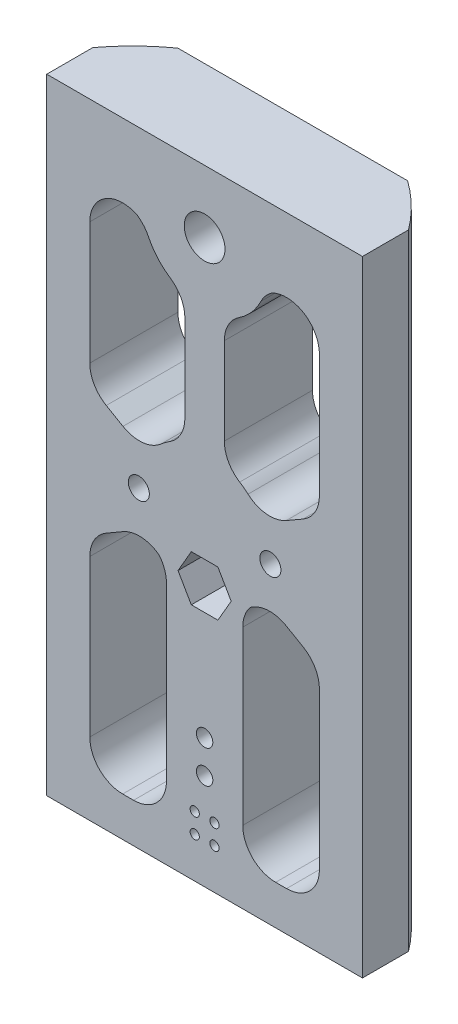
from build123d import *

# Parameters (mm, degrees)
SKETCH1_W           = 14
SKETCH1_H           = 25
BOSS_EXTRUDE1_DEPTH = 6.4
SKETCH3_W           = 14
SKETCH3_H           = 25
SKETCH3_R           = 0.7
SKETCH3_R_2         = 1.25
BOSS_EXTRUDE3_DEPTH = 7
BOSS_EXTRUDE4_START = -25
BOSS_EXTRUDE4_DEPTH = 25
BOSS_EXTRUDE5_START = 70
BOSS_EXTRUDE5_DEPTH = 70
CUT_EXTRUDE1_REACH  = 150.074
SKETCH6_R           = 2.25
CUT_EXTRUDE2_DEPTH  = 7.4
CUT_EXTRUDE4_REACH  = 150.074
SKETCH9_R           = 1.6
CUT_EXTRUDE5_DEPTH  = 7.4
CUT_EXTRUDE6_REACH  = 150.074
SKETCH11_R          = 3.1
CUT_EXTRUDE7_DEPTH  = 6
CUT_EXTRUDE8_REACH  = 150.074
FILLET1_R           = 5


with BuildPart() as part:
    # Sketch1 → Boss-Extrude1 (new body)
    with BuildSketch(Plane.XY):
        with Locations((0, -133)):
            Rectangle(SKETCH1_W, SKETCH1_H)
        Polygon((-2.275, -128.6), (-2.275, -128.15), (-2.275, -123.6), (2.275, -123.6), (2.275, -128.15), (2.275, -128.6), (2.275, -133.15), (2.275, -134.025), (3.8, -134.025), (3.8, -141.625), (1, -141.625), (1, -142.4), (-1, -142.4), (-1, -141.625), (-3.8, -141.625), (-3.8, -134.025), (-2.275, -134.025), (-2.275, -133.15), align=None, mode=Mode.SUBTRACT)
    extrude(amount=-BOSS_EXTRUDE1_DEPTH)

    # Sketch3 → Boss-Extrude3 (add)
    with BuildSketch(Plane.XY):
        with Locations((0, -133)):
            Rectangle(SKETCH3_W, SKETCH3_H)
        with Locations((-1.5, -139.325)):
            Circle(SKETCH3_R, mode=Mode.SUBTRACT)
        with Locations((-1.5, -136.325)):
            Circle(SKETCH3_R, mode=Mode.SUBTRACT)
        with Locations((1.5, -136.325)):
            Circle(SKETCH3_R, mode=Mode.SUBTRACT)
        with Locations((1.5, -139.325)):
            Circle(SKETCH3_R, mode=Mode.SUBTRACT)
        with Locations((0, -130.875)):
            Circle(SKETCH3_R_2, mode=Mode.SUBTRACT)
        with Locations((0, -125.875)):
            Circle(SKETCH3_R_2, mode=Mode.SUBTRACT)
    extrude(amount=BOSS_EXTRUDE3_DEPTH)

    # Sketch4 → Boss-Extrude4 (add)
    with BuildSketch(Plane.XZ.offset(145.5).offset(BOSS_EXTRUDE4_START)):
        with BuildLine():
            Line((-17.453939383, -6.4), (-7, -6.4))
            Line((-7, -6.4), (-7, 7))
            Line((-7, 7), (-24, 7))
            Line((-24, 7), (-24, 0))
            ThreePointArc((-24, 0), (-20.972536151, -3.45117077), (-17.453939383, -6.4))
        make_face()
        with BuildLine():
            Line((7, 7), (7, -6.4))
            Line((7, -6.4), (17.453939383, -6.4))
            ThreePointArc((17.453939383, -6.4), (20.972536151, -3.45117077), (24, 0))
            Line((24, 0), (24, 7))
            Line((24, 7), (7, 7))
        make_face()
    extrude(amount=BOSS_EXTRUDE4_DEPTH)

    # Sketch5 → Boss-Extrude5 (add)
    with BuildSketch(Plane(origin=(0, -120.5, 0), x_dir=(1, 0, 0), z_dir=(0, 1, 0)).offset(BOSS_EXTRUDE5_START)):
        with BuildLine():
            Line((17.453939383, 6.4), (-17.453939383, 6.4))
            ThreePointArc((-17.453939383, 6.4), (-20.972536151, 3.45117077), (-24, 0))
            Line((-24, 0), (-24, -7))
            Line((-24, -7), (24, -7))
            Line((24, -7), (24, 0))
            ThreePointArc((24, 0), (20.972536151, 3.45117077), (17.453939383, 6.4))
        make_face()
    extrude(amount=-BOSS_EXTRUDE5_DEPTH)

    # Sketch6 → Cut-Extrude1 (cut, up to next)
    with BuildSketch(Plane.XY.offset(7), mode=Mode.PRIVATE) as cut_extrude1_sk1:
        with Locations((0, -105.875)):
            Circle(SKETCH6_R)
    cut_extrude1_tool1 = extrude(cut_extrude1_sk1.sketch, amount=-CUT_EXTRUDE1_REACH, mode=Mode.PRIVATE) & part.part
    add(cut_extrude1_tool1.solids().sort_by_distance((0, -105.875, 7))[0], mode=Mode.SUBTRACT)

    # Sketch7 → Cut-Extrude2 (cut)
    with BuildSketch(Plane.XY.offset(7)):
        Polygon((4.041451884, -105.875), (2.020725942, -102.375), (-2.020725942, -102.375), (-4.041451884, -105.875), (-2.020725942, -109.375), (2.020725942, -109.375), align=None)
    extrude(amount=-CUT_EXTRUDE2_DEPTH, mode=Mode.SUBTRACT)

    # Sketch9 → Cut-Extrude4 (cut, up to next)
    with BuildSketch(Plane(origin=(0, 0, -6.4), x_dir=(-1, 0, 0), z_dir=(0, 0, -1)), mode=Mode.PRIVATE) as cut_extrude4_sk1:
        with Locations((-10, -98)):
            Circle(SKETCH9_R)
    cut_extrude4_tool1 = extrude(cut_extrude4_sk1.sketch, amount=-CUT_EXTRUDE4_REACH, mode=Mode.PRIVATE) & part.part
    # Sketch9 → Cut-Extrude4 (cut, up to next)
    with BuildSketch(Plane(origin=(0, 0, -6.4), x_dir=(-1, 0, 0), z_dir=(0, 0, -1)), mode=Mode.PRIVATE) as cut_extrude4_sk2:
        with Locations(Location((10, -98, 0), (0, 0, 180))):
            Circle(SKETCH9_R)
    cut_extrude4_tool2 = extrude(cut_extrude4_sk2.sketch, amount=-CUT_EXTRUDE4_REACH, mode=Mode.PRIVATE) & part.part
    add(cut_extrude4_tool1.solids().sort_by_distance((10, -98, -6.4))[0], mode=Mode.SUBTRACT)
    add(cut_extrude4_tool2.solids().sort_by_distance((-10, -98, -6.4))[0], mode=Mode.SUBTRACT)

    # Sketch10 → Cut-Extrude5 (cut)
    with BuildSketch(Plane(origin=(0, 0, -6.4), x_dir=(-1, 0, 0), z_dir=(0, 0, -1))):
        Polygon((-10, -101.233161507), (-7.2, -99.616580754), (-7.2, -96.383419246), (-10, -94.766838493), (-12.8, -96.383419246), (-12.8, -99.616580754), align=None)
        Polygon((12.8, -99.616580754), (10, -101.233161507), (7.2, -99.616580754), (7.2, -96.383419246), (10, -94.766838493), (12.8, -96.383419246), align=None)
    extrude(amount=-CUT_EXTRUDE5_DEPTH, mode=Mode.SUBTRACT)

    # Sketch11 → Cut-Extrude6 (cut, up to next)
    with BuildSketch(Plane.XY.offset(7), mode=Mode.PRIVATE) as cut_extrude6_sk1:
        with Locations((0, -60)):
            Circle(SKETCH11_R)
    cut_extrude6_tool1 = extrude(cut_extrude6_sk1.sketch, amount=-CUT_EXTRUDE6_REACH, mode=Mode.PRIVATE) & part.part
    add(cut_extrude6_tool1.solids().sort_by_distance((0, -60, 7))[0], mode=Mode.SUBTRACT)

    # Sketch12 → Cut-Extrude7 (cut)
    with BuildSketch(Plane(origin=(0, 0, -6.4), x_dir=(-1, 0, 0), z_dir=(0, 0, -1))):
        Polygon((0, -54.226497308), (-5, -57.113248654), (-5, -62.886751346), (0, -65.773502692), (5, -62.886751346), (5, -57.113248654), align=None)
    extrude(amount=-CUT_EXTRUDE7_DEPTH, mode=Mode.SUBTRACT)

    # Sketch13 → Cut-Extrude8 (cut, up to next)
    with BuildSketch(Plane(origin=(0, 0, -6.4), x_dir=(-1, 0, 0), z_dir=(0, 0, -1)), mode=Mode.PRIVATE) as cut_extrude8_sk1:
        with BuildLine():
            ThreePointArc((-3, -69.013878189), (-6.772704576, -66.66186706), (-9.062148865, -62.850869682))
            Line((-9.062148865, -62.850869682), (-17.453939383, -58.005867167))
            Line((-17.453939383, -58.005867167), (-17.453939383, -88.153903506))
            Line((-17.453939383, -88.153903506), (-8.758521814, -93.174205181))
            ThreePointArc((-8.758521814, -93.174205181), (-6.334051503, -90.261796619), (-3, -88.460607986))
            Line((-3, -88.460607986), (-3, -69.013878189))
        make_face()
    cut_extrude8_tool1 = extrude(cut_extrude8_sk1.sketch, amount=-CUT_EXTRUDE8_REACH, mode=Mode.PRIVATE) & part.part
    # Sketch13 → Cut-Extrude8 (cut, up to next)
    with BuildSketch(Plane(origin=(0, 0, -6.4), x_dir=(-1, 0, 0), z_dir=(0, 0, -1)), mode=Mode.PRIVATE) as cut_extrude8_sk2:
        with BuildLine():
            ThreePointArc((9.062148865, -62.850869682), (6.772704576, -66.66186706), (3, -69.013878189))
            Line((3, -69.013878189), (3, -88.460607986))
            ThreePointArc((3, -88.460607986), (6.334051503, -90.261796619), (8.758521814, -93.174205181))
            Line((8.758521814, -93.174205181), (17.453939383, -88.153903506))
            Line((17.453939383, -88.153903506), (17.453939383, -58.005867167))
            Line((17.453939383, -58.005867167), (9.062148865, -62.850869682))
        make_face()
    cut_extrude8_tool2 = extrude(cut_extrude8_sk2.sketch, amount=-CUT_EXTRUDE8_REACH, mode=Mode.PRIVATE) & part.part
    # Sketch13 → Cut-Extrude8 (cut, up to next)
    with BuildSketch(Plane(origin=(0, 0, -6.4), x_dir=(-1, 0, 0), z_dir=(0, 0, -1)), mode=Mode.PRIVATE) as cut_extrude8_sk3:
        with BuildLine():
            Line((-8.758521814, -102.825794819), (-17.453939383, -107.846096494))
            Line((-17.453939383, -107.846096494), (-17.453939383, -139.5))
            Line((-17.453939383, -139.5), (-5.8, -139.5))
            Line((-5.8, -139.5), (-5.8, -106.146164742))
            ThreePointArc((-5.8, -106.146164742), (-7.466180647, -104.652529334), (-8.758521814, -102.825794819))
        make_face()
    cut_extrude8_tool3 = extrude(cut_extrude8_sk3.sketch, amount=-CUT_EXTRUDE8_REACH, mode=Mode.PRIVATE) & part.part
    # Sketch13 → Cut-Extrude8 (cut, up to next)
    with BuildSketch(Plane(origin=(0, 0, -6.4), x_dir=(-1, 0, 0), z_dir=(0, 0, -1)), mode=Mode.PRIVATE) as cut_extrude8_sk4:
        with BuildLine():
            Line((17.453939383, -139.5), (17.453939383, -107.846096494))
            Line((17.453939383, -107.846096494), (8.758521814, -102.825794819))
            ThreePointArc((8.758521814, -102.825794819), (7.466180647, -104.652529334), (5.8, -106.146164742))
            Line((5.8, -106.146164742), (5.8, -139.5))
            Line((5.8, -139.5), (17.453939383, -139.5))
        make_face()
    cut_extrude8_tool4 = extrude(cut_extrude8_sk4.sketch, amount=-CUT_EXTRUDE8_REACH, mode=Mode.PRIVATE) & part.part
    add(cut_extrude8_tool1.solids().sort_by_distance((10.742167, -76.622969, -6.4))[0], mode=Mode.SUBTRACT)
    add(cut_extrude8_tool2.solids().sort_by_distance((-10.742167, -76.622969, -6.4))[0], mode=Mode.SUBTRACT)
    add(cut_extrude8_tool3.solids().sort_by_distance((11.534541, -122.314901, -6.4))[0], mode=Mode.SUBTRACT)
    add(cut_extrude8_tool4.solids().sort_by_distance((-11.534541, -122.314901, -6.4))[0], mode=Mode.SUBTRACT)

    # Fillet1
    # the kernel refuses this fillet: 5 mm, written as the material it adds along each edge
    with BuildSketch(Plane(origin=(5.8, -106.146164742, -6.4), x_dir=(0.7575363701838295, 0.6527929594049773, 0), z_dir=(0, 0, 1))) as fillet1_piece_1:
        with BuildLine():
            CenterArc((2.310120106, -4.978607617), FILLET1_R, 95.301968899, 43.945519562)
            Line((-1.477561745, -1.71464282), (0, 0))
            ThreePointArc((0, 0), (0.924048043, -0.042784766), (1.848096085, 0))
        make_face()
    extrude(amount=13.4)
    with BuildSketch(Plane(origin=(8.758521814, -102.825794819, -6.4), x_dir=(-0.62603870678312, -0.7797919835503048, 0), z_dir=(0, 0, 1))) as fillet1_piece_2:
        with BuildLine():
            CenterArc((4.300143888, 4.925479723), FILLET1_R, 188.758466443, 71.337075115)
            Line((-0.641551216, 4.164132563), (0, 0))
            ThreePointArc((0, 0), (1.720057555, 0.149040554), (3.440115111, 0))
        make_face()
    extrude(amount=13.4)
    with BuildSketch(Plane(origin=(17.453939383, -107.846096494, -6.4), x_dir=(0, -1, 0), z_dir=(0, 0, 1))) as fillet1_piece_3_section:
        with BuildLine():
            CenterArc((FILLET1_R * 0.57735026919, -FILLET1_R), FILLET1_R, 90, 60)
            Line((-FILLET1_R * 0.288675134595, -FILLET1_R * 0.5), (0, 0))
            Line((0, 0), (FILLET1_R * 0.57735026919, 0))
        make_face()
    fillet1_piece_3 = extrude(amount=13.4, mode=Mode.PRIVATE)
    fillet1_piece_3 = fillet1_piece_3 & Plane(origin=(0, -108.158373371, 18), x_dir=(0.5817979794472398, 0, -0.8133333333333321), z_dir=(0, 1, 0)) * Cylinder(30, 39, mode=Mode.PRIVATE)
    add(fillet1_piece_3)
    with BuildSketch(Plane(origin=(17.453939383, -139.5, -6.4), x_dir=(0, 1, 0), z_dir=(0, 0, 1))) as fillet1_piece_4_section:
        with BuildLine():
            CenterArc((FILLET1_R, FILLET1_R), FILLET1_R, 180, 90)
            Line((0, FILLET1_R), (0, 0))
            Line((0, 0), (FILLET1_R, 0))
        make_face()
    fillet1_piece_4 = extrude(amount=13.4, mode=Mode.PRIVATE)
    fillet1_piece_4 = fillet1_piece_4 & Plane(origin=(0, -138.368306739, 18), x_dir=(0.5817979794472398, 0, -0.8133333333333321), z_dir=(0, 1, 0)) * Cylinder(30, 47, mode=Mode.PRIVATE)
    add(fillet1_piece_4)
    with BuildSketch(Plane(origin=(5.8, -139.5, -6.4), x_dir=(0, 1, 0), z_dir=(0, 0, 1)), Plane(origin=(-5.8, -139.5, -6.4), x_dir=(-1, 0, 0), z_dir=(0, 0, 1))) as fillet1_piece_5:
        with BuildLine():
            CenterArc((FILLET1_R, -FILLET1_R), FILLET1_R, 90, 90)
            Line((0, -FILLET1_R), (0, 0))
            Line((0, 0), (FILLET1_R, 0))
        make_face()
    extrude(amount=13.4)
    with BuildSketch(Plane(origin=(-17.453939383, -139.5, -6.4), x_dir=(0, 1, 0), z_dir=(0, 0, 1))) as fillet1_piece_6_section:
        with BuildLine():
            CenterArc((FILLET1_R, -FILLET1_R), FILLET1_R, 90, 90)
            Line((0, -FILLET1_R), (0, 0))
            Line((0, 0), (FILLET1_R, 0))
        make_face()
    fillet1_piece_6 = extrude(amount=13.4, mode=Mode.PRIVATE)
    fillet1_piece_6 = fillet1_piece_6 & Plane(origin=(0, -138.368306739, 18), x_dir=(-0.799999999999999, 0, -0.6000000000000013), z_dir=(0, 1, 0)) * Cylinder(30, 47, mode=Mode.PRIVATE)
    add(fillet1_piece_6)
    with BuildSketch(Plane(origin=(-5.8, -106.146164742, -6.4), x_dir=(-0.7575363701838297, 0.6527929594049768, 0), z_dir=(0, 0, 1))) as fillet1_piece_7:
        with BuildLine():
            CenterArc((2.310120106, 4.978607617), FILLET1_R, 220.752511538, 43.945519562)
            Line((-1.477561745, 1.71464282), (0, 0))
            ThreePointArc((0, 0), (0.924048043, 0.042784766), (1.848096085, 0))
        make_face()
    extrude(amount=13.4)
    with BuildSketch(Plane(origin=(-8.758521814, -102.825794819, -6.4), x_dir=(0.6260387067831015, -0.7797919835503196, 0), z_dir=(0, 0, 1)), Plane(origin=(8.758521814, -93.174205181, -6.4), x_dir=(-0.6260387067831222, 0.779791983550303, 0), z_dir=(0, 0, 1))) as fillet1_piece_8:
        with BuildLine():
            CenterArc((4.300143888, -4.925479723), FILLET1_R, 99.904458442, 71.337075115)
            Line((-0.641551216, -4.164132563), (0, 0))
            ThreePointArc((0, 0), (1.720057555, -0.149040554), (3.440115111, 0))
        make_face()
    extrude(amount=13.4)
    with BuildSketch(Plane(origin=(-17.453939383, -107.846096494, -6.4), x_dir=(0.8660254037844315, 0.5000000000000123, 0), z_dir=(0, 0, 1))) as fillet1_piece_9_section:
        with BuildLine():
            CenterArc((FILLET1_R * 0.57735026919, -FILLET1_R), FILLET1_R, 90, 60)
            Line((-FILLET1_R * 0.288675134595, -FILLET1_R * 0.5), (0, 0))
            Line((0, 0), (FILLET1_R * 0.57735026919, 0))
        make_face()
    fillet1_piece_9 = extrude(amount=13.4, mode=Mode.PRIVATE)
    fillet1_piece_9 = fillet1_piece_9 & Plane(origin=(0, -108.158373371, 18), x_dir=(-0.799999999999999, 0, -0.6000000000000013), z_dir=(0, 1, 0)) * Cylinder(30, 39, mode=Mode.PRIVATE)
    add(fillet1_piece_9)
    with BuildSketch(Plane(origin=(-17.453939383, -58.005867167, -6.4), x_dir=(0.8660254037844394, -0.49999999999999867, 0), z_dir=(0, 0, 1))) as fillet1_piece_10_section:
        with BuildLine():
            CenterArc((FILLET1_R * 1.73205080757, -FILLET1_R), FILLET1_R, 90, 120)
            Line((FILLET1_R * 0.866025403784, -FILLET1_R * 1.5), (0, 0))
            Line((0, 0), (FILLET1_R * 1.73205080757, 0))
        make_face()
    fillet1_piece_10 = extrude(amount=13.4, mode=Mode.PRIVATE)
    fillet1_piece_10 = fillet1_piece_10 & Plane(origin=(0, -61.191165079, 18), x_dir=(-0.799999999999999, 0, -0.6000000000000013), z_dir=(0, 1, 0)) * Cylinder(30, 62, mode=Mode.PRIVATE)
    add(fillet1_piece_10)
    with BuildSketch(Plane(origin=(-17.453939383, -88.153903506, -6.4), x_dir=(0, 1, 0), z_dir=(0, 0, 1))) as fillet1_piece_11_section:
        with BuildLine():
            CenterArc((FILLET1_R * 0.57735026919, -FILLET1_R), FILLET1_R, 90, 60)
            Line((-FILLET1_R * 0.288675134595, -FILLET1_R * 0.5), (0, 0))
            Line((0, 0), (FILLET1_R * 0.57735026919, 0))
        make_face()
    fillet1_piece_11 = extrude(amount=13.4, mode=Mode.PRIVATE)
    fillet1_piece_11 = fillet1_piece_11 & Plane(origin=(0, -87.841626629, 18), x_dir=(-0.799999999999999, 0, -0.6000000000000013), z_dir=(0, 1, 0)) * Cylinder(30, 39, mode=Mode.PRIVATE)
    add(fillet1_piece_11)
    with BuildSketch(Plane(origin=(-8.758521814, -93.174205181, -6.4), x_dir=(-0.8660254037844435, 0.49999999999999156, 0), z_dir=(0, 0, 1))) as fillet1_piece_12:
        with BuildLine():
            CenterArc((4.213263339, -5), FILLET1_R, 90, 71.337075115)
            ThreePointArc((-0.523824374, -3.4), (-0.114609592, -1.722694321), (0, 0))
            Line((0, 0), (4.213263339, 0))
        make_face()
    extrude(amount=13.4)
    with BuildSketch(Plane(origin=(-3, -88.460607986, -6.4), x_dir=(-0.9074530571155881, -0.42015348282689874, 0), z_dir=(0, 0, 1))) as fillet1_piece_13:
        with BuildLine():
            CenterArc((3.214124019, -4.958505447), FILLET1_R, 97.386674756, 57.769047364)
            Line((-1.323141267, -2.857738033), (0, 0))
            ThreePointArc((0, 0), (1.285649607, -0.082989105), (2.571299215, 0))
        make_face()
    extrude(amount=13.4)
    with BuildSketch(Plane(origin=(17.453939383, -88.153903506, -6.4), x_dir=(0, 1, 0), z_dir=(0, 0, 1))) as fillet1_piece_14_section:
        with BuildLine():
            CenterArc((FILLET1_R * 0.57735026919, FILLET1_R), FILLET1_R, 210, 60)
            Line((-FILLET1_R * 0.288675134595, FILLET1_R * 0.5), (0, 0))
            Line((0, 0), (FILLET1_R * 0.57735026919, 0))
        make_face()
    fillet1_piece_14 = extrude(amount=13.4, mode=Mode.PRIVATE)
    fillet1_piece_14 = fillet1_piece_14 & Plane(origin=(0, -87.841626629, 18), x_dir=(0.5817979794472398, 0, -0.8133333333333321), z_dir=(0, 1, 0)) * Cylinder(30, 39, mode=Mode.PRIVATE)
    add(fillet1_piece_14)
    with BuildSketch(Plane(origin=(-9.062148865, -62.850869682, -6.4), x_dir=(0.3690548403008551, -0.929407620396191, 0), z_dir=(0, 0, 1))) as fillet1_piece_15:
        with BuildLine():
            CenterArc((1.755309209, -4.986609194), FILLET1_R, 94.194237009, 34.148424345)
            Line((-1.346506739, -1.065035807), (0, 0))
            ThreePointArc((0, 0), (0.694809895, -0.025442532), (1.38961979, 0))
        make_face()
    extrude(amount=13.4)
    with BuildSketch(Plane(origin=(-3, -69.013878189, -6.4), x_dir=(-0.8991997125557425, 0.4375384291004277, 0), z_dir=(0, 0, 1))) as fillet1_piece_16:
        with BuildLine():
            CenterArc((3.14859528, 4.956785244), FILLET1_R, 205.946928397, 56.514623377)
            Line((-1.347403283, 2.769093098), (0, 0))
            ThreePointArc((0, 0), (1.246318965, 0.082108036), (2.49263793, 0))
        make_face()
    extrude(amount=13.4)
    with BuildSketch(Plane(origin=(3, -88.460607986, -6.4), x_dir=(0.9074530571156046, -0.42015348282686293, 0), z_dir=(0, 0, 1))) as fillet1_piece_17:
        with BuildLine():
            CenterArc((3.214124019, 4.958505447), FILLET1_R, 204.84427788, 57.769047364)
            Line((-1.323141267, 2.857738033), (0, 0))
            ThreePointArc((0, 0), (1.285649607, 0.082989105), (2.571299215, 0))
        make_face()
    extrude(amount=13.4)
    with BuildSketch(Plane(origin=(3, -69.013878189, -6.4), x_dir=(0.899199712555735, 0.43753842910044294, 0), z_dir=(0, 0, 1))) as fillet1_piece_18:
        with BuildLine():
            CenterArc((3.14859528, -4.956785244), FILLET1_R, 97.538448226, 56.514623377)
            Line((-1.347403283, -2.769093098), (0, 0))
            ThreePointArc((0, 0), (1.246318965, -0.082108036), (2.49263793, 0))
        make_face()
    extrude(amount=13.4)
    with BuildSketch(Plane(origin=(9.062148865, -62.850869682, -6.4), x_dir=(0.8660254037844507, 0.4999999999999791, 0), z_dir=(0, 0, 1))) as fillet1_piece_19:
        with BuildLine():
            CenterArc((1.716794009, -5), FILLET1_R, 90, 34.148424345)
            ThreePointArc((-1.089899198, -0.862068966), (-0.529165988, -0.450989434), (0, 0))
            Line((0, 0), (1.716794009, 0))
        make_face()
    extrude(amount=13.4)
    with BuildSketch(Plane(origin=(17.453939383, -58.005867167, -6.4), x_dir=(0, -1, 0), z_dir=(0, 0, 1))) as fillet1_piece_20_section:
        with BuildLine():
            CenterArc((FILLET1_R * 1.73205080757, -FILLET1_R), FILLET1_R, 90, 120)
            Line((FILLET1_R * 0.866025403784, -FILLET1_R * 1.5), (0, 0))
            Line((0, 0), (FILLET1_R * 1.73205080757, 0))
        make_face()
    fillet1_piece_20 = extrude(amount=13.4, mode=Mode.PRIVATE)
    fillet1_piece_20 = fillet1_piece_20 & Plane(origin=(0, -61.191165079, 18), x_dir=(0.5817979794472398, 0, -0.8133333333333321), z_dir=(0, 1, 0)) * Cylinder(30, 62, mode=Mode.PRIVATE)
    add(fillet1_piece_20)


solid = part.part
